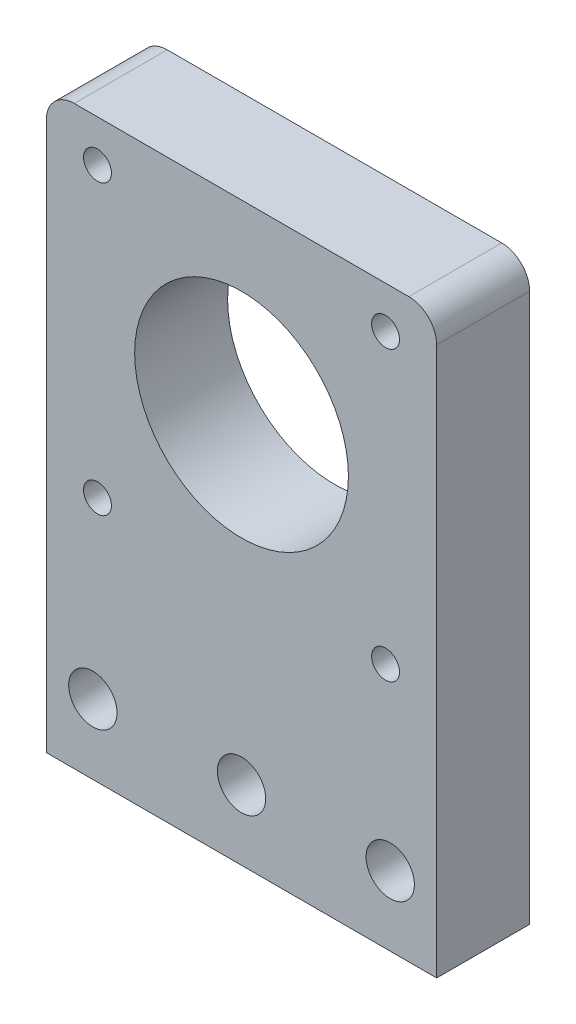
from build123d import *

# Parameters (mm, degrees)
SKETCH1_W           = 42
SKETCH1_H           = 62
SKETCH1_R           = 11.5
BOSS_EXTRUDE1_DEPTH = 10
FILLET2_R           = 3
SKETCH2_R           = 1.5
CUT_EXTRUDE1_DEPTH  = 76.55130707
SKETCH3_R           = 2.6
CUT_EXTRUDE2_DEPTH  = 76.55130707


with BuildPart() as part:
    # Sketch1 → Boss-Extrude1 (new body)
    with BuildSketch(Plane.XY):
        with Locations((21, 31)):
            Rectangle(SKETCH1_W, SKETCH1_H)
        with Locations((21, 42)):
            Circle(SKETCH1_R, mode=Mode.SUBTRACT)
    extrude(amount=BOSS_EXTRUDE1_DEPTH)

    # Fillet2
    fillet2_edges = [part.edges().sort_by_distance(p)[0] for p in [
        (42, 62, 5),
        (0, 62, 5),
    ]]
    fillet(fillet2_edges, radius=FILLET2_R)

    # Sketch2 → Cut-Extrude1 (cut, through all)
    with BuildSketch(Plane.XY.offset(10)):
        with Locations((5.5, 57.5)):
            Circle(SKETCH2_R)
        with Locations((36.5, 57.5)):
            Circle(SKETCH2_R)
        with Locations((5.5, 26.5)):
            Circle(SKETCH2_R)
        with Locations((36.5, 26.5)):
            Circle(SKETCH2_R)
    extrude(amount=-CUT_EXTRUDE1_DEPTH, mode=Mode.SUBTRACT)

    # Sketch3 → Cut-Extrude2 (cut, through all)
    with BuildSketch(Plane.XY.offset(10)):
        with Locations((5, 7.5)):
            Circle(SKETCH3_R)
        with Locations((21, 7.5)):
            Circle(SKETCH3_R)
        with Locations((37, 7.5)):
            Circle(SKETCH3_R)
    extrude(amount=-CUT_EXTRUDE2_DEPTH, mode=Mode.SUBTRACT)


solid = part.part
